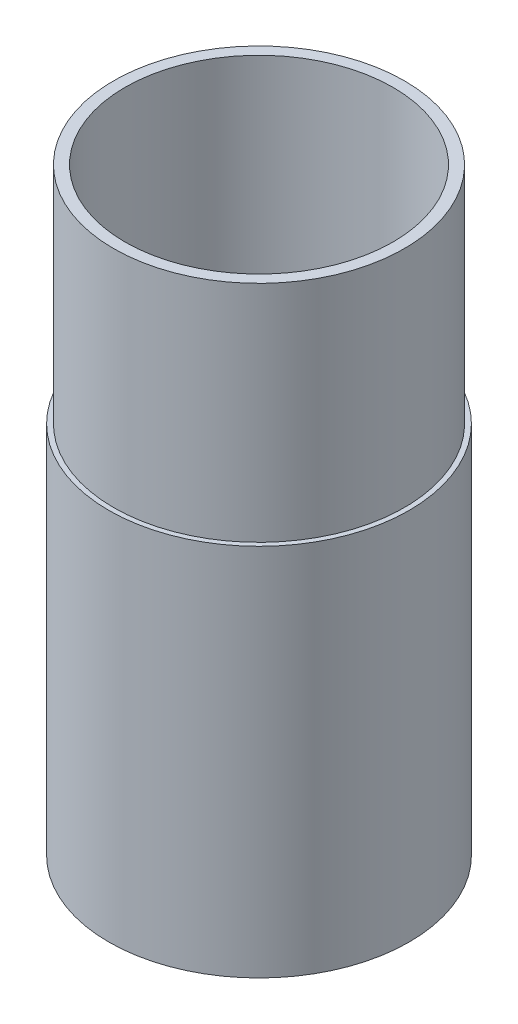
from build123d import *


with BuildPart() as part:
    # Sketch1 → Revolve1 (revolve)
    with BuildSketch(Plane.XY):
        Polygon((22.762367851, 58.026263883), (22.762367851, -43.573736117), (25.5143, -43.573736117), (25.5143, 19.926263883), (24.692767851, 19.926263883), (24.692767851, 58.026263883), align=None)
    revolve(axis=Axis((0, 0, 0), (0, 1, 0)))


solid = part.part
